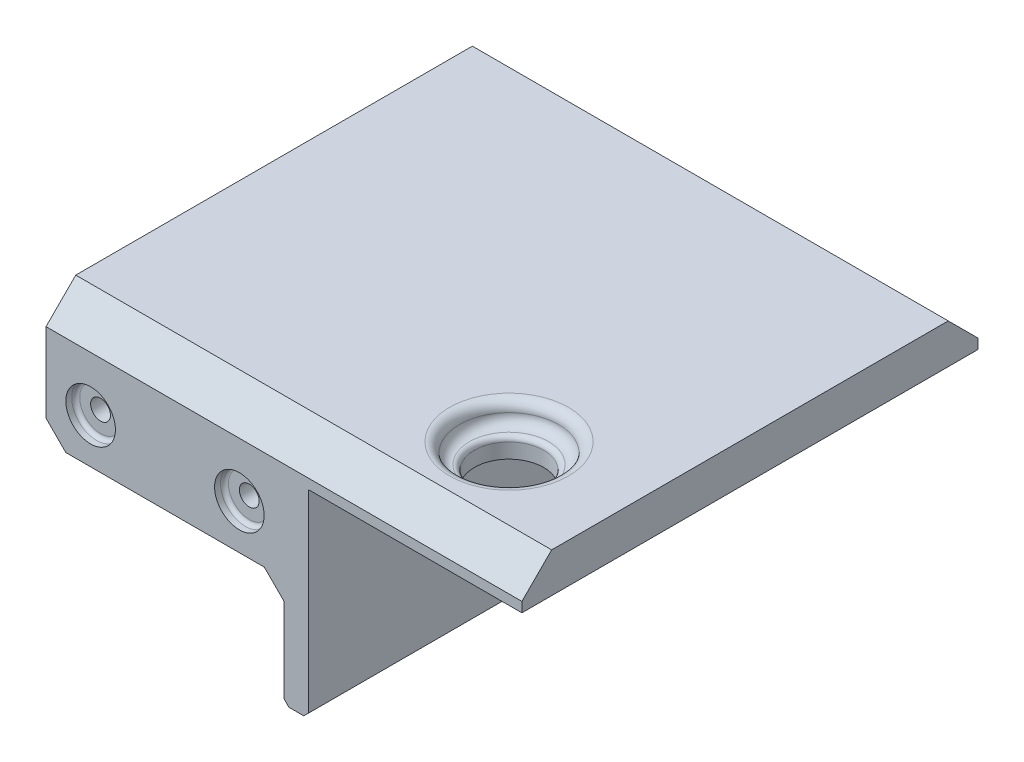
from build123d import *
from OCP.BRepFilletAPI import BRepFilletAPI_MakeChamfer

# Parameters (mm, degrees)
SKETCH_1_W          = 24
SKETCH_1_H          = 20
SKETCH_1_R          = 1
EXTRUDE_1_DEPTH     = 3
SKETCH_2_W          = 24
SKETCH_2_H          = 4
EXTRUDE_2_DEPTH     = 40
SKETCH_3_W          = 24
SKETCH_3_H          = 4
SKETCH_3_H_2        = 9
SKETCH_3_R          = 1
EXTRUDE_3_DEPTH     = 3
EXTRUDE_START       = -3
SKETCH_4_R          = 1
EXTRUDE_4_DEPTH     = 3
CHAMFER_1_SIZE      = 2
SKETCH_5_R          = 2.5
CUT_EXTRUDE_1_DEPTH = 1
SKETCH_6_R          = 2.5
CUT_EXTRUDE_2_DEPTH = 1
FILLET_1_R          = 0.4
CHAMFER_3_SIZE      = 2
SKETCH_9_W          = 46
SKETCH_9_H          = 4
EXTRUDE_5_DEPTH     = 24
CHAMFER_2_SIZE      = 3
SKETCH_10_W         = 2.5
SKETCH_10_H         = 46
EXTRUDE_6_DEPTH     = 20
CHAMFER_4_SIZE      = 0.5
CHAMFER_5_SIZE      = 1.979898987
CHAMFER_5_SIZE_2    = 2.8
CHAMFER_6_SIZE      = 2
CHAMFER_6_SIZE_2    = 1.999970413
CHAMFER_7_SIZE      = 2
SKETCH_11_W         = 3
SKETCH_11_H         = 19.5
EXTRUDE_7_DEPTH     = 1.7
CHAMFER_8_SIZE      = 1.7
SKETCH_12_R         = 3.5
CUT_EXTRUDE_5_DEPTH = 4
SKETCH_13_R         = 5
CUT_EXTRUDE_6_DEPTH = 2
FILLET_3_R          = 1
SKETCH_14_R         = 2.6
EXTRUDE_8_DEPTH     = 1
FILLET_4_R          = 0.2
FILLET_5_R          = 0.5


# Some blends are built 0.0001 mm under size
with BuildPart() as part:
    # Эскиз1 → Бобышка-Вытянуть1 (new body)
    with BuildSketch(Plane.XY):
        with Locations((14.6, -38.877499952)):
            Rectangle(SKETCH_1_W, SKETCH_1_H)
        with Locations((7.1, -37.377499952)):
            Circle(SKETCH_1_R, mode=Mode.SUBTRACT)
        with Locations((22.1, -37.377499952)):
            Circle(SKETCH_1_R, mode=Mode.SUBTRACT)
        with Locations((14.6, -37.877499952)):
            Circle(SKETCH_1_R, mode=Mode.SUBTRACT)
        with Locations((21.6, -44.877499952)):
            Circle(SKETCH_1_R, mode=Mode.SUBTRACT)
        with Locations((7.6, -44.877499952)):
            Circle(SKETCH_1_R, mode=Mode.SUBTRACT)
    extrude(amount=EXTRUDE_1_DEPTH)

    # Эскиз2 → Бобышка-Вытянуть2 (add)
    with BuildSketch(Plane.XY.offset(3)):
        with Locations((14.6, -30.877499952)):
            Rectangle(SKETCH_2_W, SKETCH_2_H)
    extrude(amount=EXTRUDE_2_DEPTH)

    # Эскиз3 → Бобышка-Вытянуть3 (add)
    # profile 1 of 2: a face of its own
    with BuildSketch(Plane.XY.offset(43)):
        with Locations((14.6, -30.877499952)):
            Rectangle(SKETCH_3_W, SKETCH_3_H)
    # profile 2 of 2: a face of its own
    with BuildSketch(Plane.XY.offset(43)):
        with Locations((14.6, -37.377499952)):
            Rectangle(SKETCH_3_W, SKETCH_3_H_2)
        with Locations((7.1, -37.377499952)):
            Circle(SKETCH_3_R, mode=Mode.SUBTRACT)
        with Locations((22.1, -37.377499952)):
            Circle(SKETCH_3_R, mode=Mode.SUBTRACT)
    extrude(amount=EXTRUDE_3_DEPTH)

    # Эскиз4 → Бобышка-Вытянуть4 (add)
    with BuildSketch(Plane.XY.offset(3).offset(EXTRUDE_START)):
        with Locations((7.1, -37.377499952)):
            Circle(SKETCH_4_R)
        with Locations((22.1, -37.377499952)):
            Circle(SKETCH_4_R)
    extrude(amount=EXTRUDE_4_DEPTH)

    # Фаска1
    chamfer_1_edges = [part.edges().sort_by_distance(p)[0] for p in [
        (14.6, -32.877499952, 43),
        (14.6, -32.877499952, 3),
    ]]
    chamfer(chamfer_1_edges, length=CHAMFER_1_SIZE)

    # Эскиз5 → Вырез-Вытянуть1 (cut)
    with BuildSketch(Plane.XY.offset(46)):
        with Locations((7.1, -37.377499952)):
            Circle(SKETCH_5_R)
        with Locations((22.1, -37.377499952)):
            Circle(SKETCH_5_R)
    extrude(amount=-CUT_EXTRUDE_1_DEPTH, mode=Mode.SUBTRACT)

    # Эскиз6 → Вырез-Вытянуть2 (cut)
    with BuildSketch(Plane(origin=(0, 0, 0), x_dir=(-1, 0, 0), z_dir=(0, 0, -1))):
        with Locations((-14.6, -37.877499952)):
            Circle(SKETCH_6_R)
        with Locations((-7.6, -44.877499952)):
            Circle(SKETCH_6_R)
        with Locations((-21.6, -44.877499952)):
            Circle(SKETCH_6_R)
    extrude(amount=-CUT_EXTRUDE_2_DEPTH, mode=Mode.SUBTRACT)

    # Скругление1
    fillet_1_edges = [part.edges().sort_by_distance(p)[0] for p in [
        (19.6, -37.377499952, 45),
        (17.1, -37.877499952, 1),
        (10.1, -44.877499952, 1),
        (24.1, -44.877499952, 1),
        (4.6, -37.377499952, 45),
    ]]
    fillet(fillet_1_edges, radius=FILLET_1_R)

    # Фаска3
    chamfer_3_edges = [part.edges().sort_by_distance(p)[0] for p in [
        (2.6, -41.877499952, 44.5),
        (26.6, -41.877499952, 44.5),
        (26.6, -48.877499952, 1.5),
        (2.6, -48.877499952, 1.5),
    ]]
    chamfer(chamfer_3_edges, length=CHAMFER_3_SIZE)

    # Эскиз9 → Бобышка-Вытянуть5 (add)
    with BuildSketch(Plane(origin=(26.6, 0, 0), x_dir=(0, 0, -1), z_dir=(1, 0, 0))):
        with Locations((-23, -30.877499952)):
            Rectangle(SKETCH_9_W, SKETCH_9_H)
    extrude(amount=EXTRUDE_5_DEPTH)

    # Фаска2
    chamfer_2_edges = [part.edges().sort_by_distance(p)[0] for p in [
        (26.6, -28.877499952, 0),
        (26.6, -28.877499952, 46),
    ]]
    chamfer(chamfer_2_edges, length=CHAMFER_2_SIZE)

    # Эскиз10 → Бобышка-Вытянуть6 (add)
    with BuildSketch(Plane.XZ.offset(32.877499952)):
        with Locations((27.85, 23)):
            Rectangle(SKETCH_10_W, SKETCH_10_H)
    extrude(amount=EXTRUDE_6_DEPTH)

    # Фаска4
    chamfer_4_edges = [part.edges().sort_by_distance(p)[0] for p in [
        (26.6, -52.877499952, 23),
        (29.1, -52.877499952, 23),
    ]]
    chamfer(chamfer_4_edges, length=CHAMFER_4_SIZE)

    # Фаска5
    chamfer_5_edges_1 = [part.edges().sort_by_distance(p)[0] for p in [
        (26.6, -46.877499952, 1.5),
    ]]
    chamfer_5_side_1 = [part.faces().sort_by_distance(p)[0] for p in [
        (26.6, -46.917097932, 1.5),
    ]]
    chamfer_5_edges_2 = [part.edges().sort_by_distance(p)[0] for p in [
        (26.6, -39.877499952, 44.5),
    ]]
    chamfer_5_side_2 = [part.faces().sort_by_distance(p)[0] for p in [
        (26.6, -39.917097932, 44.5),
    ]]
    chamfer_5 = BRepFilletAPI_MakeChamfer(part.part.solid().wrapped)
    for e in chamfer_5_edges_1:
        chamfer_5.Add(CHAMFER_5_SIZE - 0.0001, CHAMFER_5_SIZE_2 - 0.0001, e.wrapped, chamfer_5_side_1[0].wrapped)
    for e in chamfer_5_edges_2:
        chamfer_5.Add(CHAMFER_5_SIZE - 0.0001, CHAMFER_5_SIZE_2 - 0.0001, e.wrapped, chamfer_5_side_2[0].wrapped)
    add(Compound.cast(chamfer_5.Shape()), mode=Mode.REPLACE)  # a hair under: the kernel refuses the full size

    # Фаска6
    # the kernel refuses this chamfer: 2, 1.999970413 mm, written as the material it adds along each edge
    with BuildSketch(Plane(origin=(26.6, -41.857298939, 43), x_dir=(-0.9996223235768031, 0.027481088168278975, 0), z_dir=(0, 0, 1)), Plane(origin=(26.6, -48.857298939, 0), x_dir=(-0.9996223235768031, 0.027481088168278975, 0), z_dir=(0, 0, 1))) as chamfer_6_piece_1:
        Polygon((CHAMFER_6_SIZE * 0.999621916911, CHAMFER_6_SIZE * 0.0274958766106), (-CHAMFER_6_SIZE_2 * 0.0274810881627, CHAMFER_6_SIZE_2 * 0.999622323373), (0, 0), align=None)
    extrude(amount=3)

    # Фаска7
    chamfer_7_edges = [part.edges().sort_by_distance(p)[0] for p in [
        (26.6, -32.877499952, 23),
    ]]
    chamfer(chamfer_7_edges, length=CHAMFER_7_SIZE)

    # Эскиз11 → Бобышка-Вытянуть7 (add)
    with BuildSketch(Plane.ZY.offset(-26.6)):
        with Locations((23, -42.627499952)):
            Rectangle(SKETCH_11_W, SKETCH_11_H)
        with Locations((34, -42.627499952)):
            Rectangle(SKETCH_11_W, SKETCH_11_H)
        with Locations((12, -42.627499952)):
            Rectangle(SKETCH_11_W, SKETCH_11_H)
    extrude(amount=EXTRUDE_7_DEPTH)

    # Фаска8
    chamfer_8_edges = [part.edges().sort_by_distance(p)[0] for p in [
        (24.9, -52.377499952, 12),
        (24.9, -52.377499952, 23),
        (24.9, -52.377499952, 34),
    ]]
    chamfer(chamfer_8_edges, length=CHAMFER_8_SIZE - 0.0001)  # a hair under: the kernel refuses the full size

    # Эскиз12 → Вырез-Вытянуть5 (cut)
    with BuildSketch(Plane.XZ.offset(32.877499952)):
        with Locations(Location((39, 35.7, 0), (0, 0, 270))):
            Circle(SKETCH_12_R)
    extrude(amount=-CUT_EXTRUDE_5_DEPTH, mode=Mode.SUBTRACT)

    # Эскиз13 → Вырез-Вытянуть6 (cut)
    with BuildSketch(Plane(origin=(0, -28.877499952, 0), x_dir=(1, 0, 0), z_dir=(0, 1, 0))):
        with Locations(Location((39, -35.7, 0), (0, 0, 270))):
            Circle(SKETCH_13_R)
    extrude(amount=-CUT_EXTRUDE_6_DEPTH, mode=Mode.SUBTRACT)

    # Скругление3
    fillet_3_edges = [part.edges().sort_by_distance(p)[0] for p in [
        (39, -28.877499952, 30.7),
        (39, -30.877499952, 30.7),
    ]]
    fillet(fillet_3_edges, radius=FILLET_3_R - 0.0001)  # a hair under: the kernel refuses the full size

    # Эскиз14 → Бобышка-Вытянуть8 (add)
    with BuildSketch(Plane.XZ.offset(32.877499952)):
        with Locations(Location((39, 9.7, 0), (0, 0, 90))):
            Circle(SKETCH_14_R)
    extrude(amount=EXTRUDE_8_DEPTH)

    # Скругление4
    fillet_4_edges = [part.edges().sort_by_distance(p)[0] for p in [
        (39, -32.877499952, 7.1),
    ]]
    fillet(fillet_4_edges, radius=FILLET_4_R)

    # Скругление5
    fillet_5_edges = [part.edges().sort_by_distance(p)[0] for p in [
        (39, -30.877499952, 39.2),
    ]]
    fillet(fillet_5_edges, radius=FILLET_5_R)


solid = part.part
